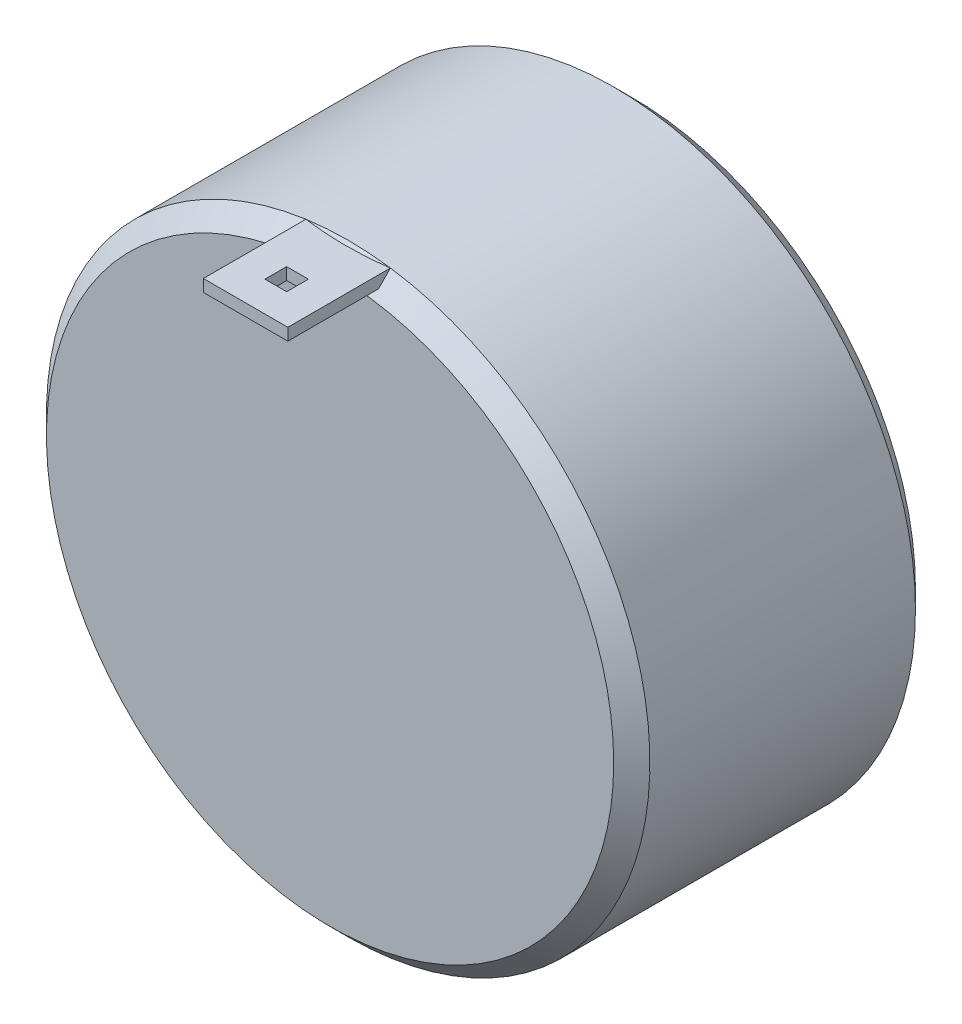
from build123d import *

# Parameters (mm, degrees)
SKETCH1_R                = 25
BOSS_EXTRUDE1_DEPTH      = 25
CHAMFER1_SIZE            = 1.5
BOSS_EXTRUDE2_DEPTH      = 7
BOSS_EXTRUDE2_DEPTH_BACK = 7
SKETCH2_W                = 7
SKETCH2_H                = 1
SKETCH3_W                = 1.8
SKETCH3_H                = 1.8
CUT_EXTRUDE1_DEPTH       = 7


with BuildPart() as part:
    # Sketch1 → Boss-Extrude1 (new body)
    with BuildSketch(Plane.XY):
        with Locations((25, 25)):
            Circle(SKETCH1_R)
    extrude(amount=BOSS_EXTRUDE1_DEPTH)

    # Chamfer1
    chamfer1_edges = [part.edges().sort_by_distance(p)[0] for p in [
        (0, 25, 0),
        (0, 25, 25),
    ]]
    chamfer(chamfer1_edges, length=CHAMFER1_SIZE)

    # Sketch2 → Boss-Extrude2 (add, two sides: drawn at the far end of the back side and taken through both)
    with BuildSketch(Plane.XY.offset(25).offset(-BOSS_EXTRUDE2_DEPTH_BACK)):
        with Locations((25, 49.253787589)):
            Rectangle(SKETCH2_W, SKETCH2_H)
    extrude(amount=BOSS_EXTRUDE2_DEPTH + BOSS_EXTRUDE2_DEPTH_BACK)

    # Sketch3 → Cut-Extrude1 (cut)
    with BuildSketch(Plane(origin=(0, 49.753787589, 0), x_dir=(1, 0, 0), z_dir=(0, 1, 0))):
        with Locations((25, -28.6)):
            Rectangle(SKETCH3_W, SKETCH3_H)
    extrude(amount=-CUT_EXTRUDE1_DEPTH, mode=Mode.SUBTRACT)


solid = part.part
